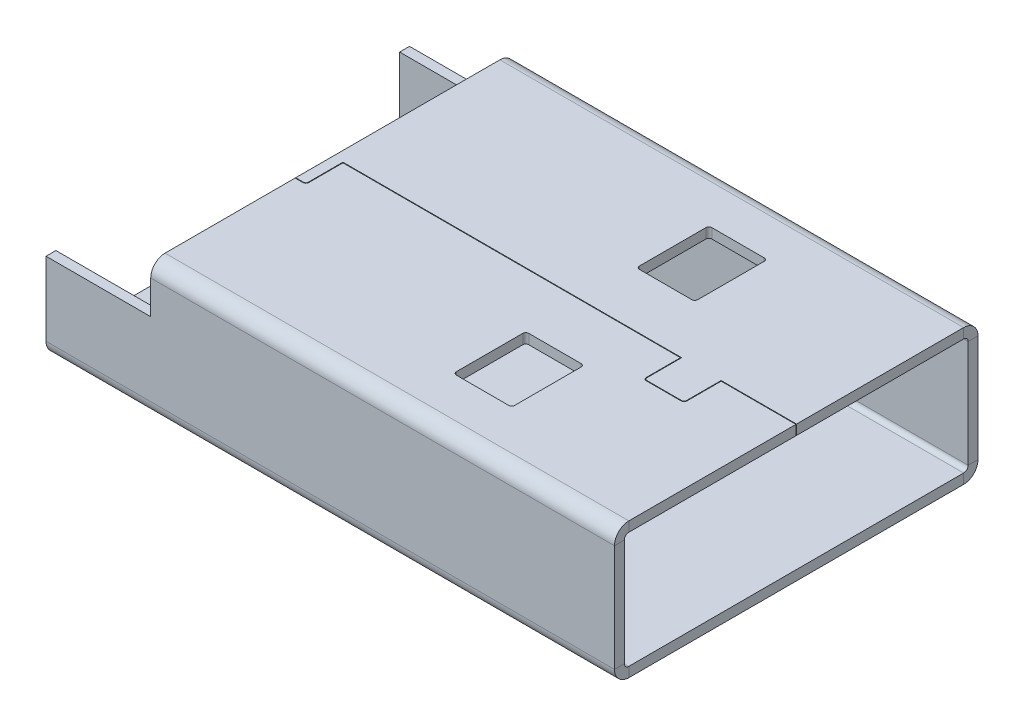
from build123d import *

# Parameters (mm, degrees)
BASE_FLANGE1_DEPTH  = 19
CUT_EXTRUDE1_DEPTH  = 0.33
TAB1_DEPTH          = 0.33
CUT_EXTRUDE2_DEPTH  = 21.457693541
SKETCH_1_W          = 4.170383739
SKETCH_1_H          = 15.60949608
CUT_EXTRUDE_1_DEPTH = 1.6


# Sheet-metal steps are written as plain solids
with BuildPart() as part:
    # Sketch1 → Base-Flange1 (new body)
    with BuildSketch(Plane(origin=(0, 0, 0), x_dir=(0, 0, -1), z_dir=(1, 0, 0))):
        with BuildLine():
            Line((0.01, 2.27), (5.595, 2.27))
            ThreePointArc((5.595, 2.27), (5.934411255, 2.129411255), (6.075, 1.79))
            Line((6.075, 1.79), (6.075, -1.79))
            ThreePointArc((6.075, -1.79), (5.934411255, -2.129411255), (5.595, -2.27))
            Line((5.595, -2.27), (-5.595, -2.27))
            ThreePointArc((-5.595, -2.27), (-5.934411255, -2.129411255), (-6.075, -1.79))
            Line((-6.075, -1.79), (-6.075, 1.79))
            ThreePointArc((-6.075, 1.79), (-5.934411255, 2.129411255), (-5.595, 2.27))
            Line((-5.595, 2.27), (-0.01, 2.27))
            Line((-0.01, 2.27), (-0.01, 1.94))
            Line((-0.01, 1.94), (-5.595, 1.94))
            ThreePointArc((-5.595, 1.94), (-5.701066017, 1.896066017), (-5.745, 1.79))
            Line((-5.745, 1.79), (-5.745, -1.79))
            ThreePointArc((-5.745, -1.79), (-5.701066017, -1.896066017), (-5.595, -1.94))
            Line((-5.595, -1.94), (5.595, -1.94))
            ThreePointArc((5.595, -1.94), (5.701066017, -1.896066017), (5.745, -1.79))
            Line((5.745, -1.79), (5.745, 1.79))
            ThreePointArc((5.745, 1.79), (5.701066017, 1.896066017), (5.595, 1.94))
            Line((5.595, 1.94), (0.01, 1.94))
            Line((0.01, 1.94), (0.01, 2.27))
        make_face()
    extrude(amount=BASE_FLANGE1_DEPTH)

    # Sketch6 → Cut-Extrude1 (cut)
    with BuildSketch(Plane(origin=(0, 2.27, 0), x_dir=(1, 0, 0), z_dir=(0, 1, 0))):
        with BuildLine():
            Line((16.5, 0.01), (16.5, -1.15))
            ThreePointArc((16.5, -1.15), (16.470710678, -1.220710678), (16.4, -1.25))
            Line((16.4, -1.25), (15.24, -1.25))
            ThreePointArc((15.24, -1.25), (15.169289322, -1.220710678), (15.14, -1.15))
            Line((15.14, -1.15), (15.14, 0.01))
            Line((15.14, 0.01), (16.5, 0.01))
        make_face()
        with BuildLine():
            Line((3.86, 0.01), (2.5, 0.01))
            Line((2.5, 0.01), (2.5, -1.15))
            ThreePointArc((2.5, -1.15), (2.529289322, -1.220710678), (2.6, -1.25))
            Line((2.6, -1.25), (3.76, -1.25))
            ThreePointArc((3.76, -1.25), (3.830710678, -1.220710678), (3.86, -1.15))
            Line((3.86, -1.15), (3.86, 0.01))
        make_face()
    extrude(amount=-CUT_EXTRUDE1_DEPTH, mode=Mode.SUBTRACT)

    # Sketch7 → Tab1 (add)
    with BuildSketch(Plane(origin=(0, 2.27, 0), x_dir=(1, 0, 0), z_dir=(0, 1, 0))):
        with BuildLine():
            Line((15.16, -0.01), (15.16, 0.01))
            Line((15.16, 0.01), (16.48, 0.01))
            Line((16.48, 0.01), (16.48, -0.01))
            Line((16.48, -0.01), (16.48, -1.15))
            ThreePointArc((16.48, -1.15), (16.456568542, -1.206568542), (16.4, -1.23))
            Line((16.4, -1.23), (15.24, -1.23))
            ThreePointArc((15.24, -1.23), (15.183431458, -1.206568542), (15.16, -1.15))
            Line((15.16, -1.15), (15.16, -0.01))
        make_face()
        with BuildLine():
            Line((2.52, -0.01), (2.52, 0.01))
            Line((2.52, 0.01), (3.84, 0.01))
            Line((3.84, 0.01), (3.84, -0.01))
            Line((3.84, -0.01), (3.84, -1.15))
            ThreePointArc((3.84, -1.15), (3.816568542, -1.206568542), (3.76, -1.23))
            Line((3.76, -1.23), (2.6, -1.23))
            ThreePointArc((2.6, -1.23), (2.543431458, -1.206568542), (2.52, -1.15))
            Line((2.52, -1.15), (2.52, -0.01))
        make_face()
    extrude(amount=-TAB1_DEPTH)

    # Sketch10 → Cut-Extrude2 (cut, through all)
    with BuildSketch(Plane(origin=(0, 2.27, 0), x_dir=(1, 0, 0), z_dir=(0, 1, 0))):
        with BuildLine():
            Line((11.9, -1.84), (13.65, -1.84))
            ThreePointArc((13.65, -1.84), (13.720710678, -1.869289322), (13.75, -1.94))
            Line((13.75, -1.94), (13.75, -4.16))
            ThreePointArc((13.75, -4.16), (13.720710678, -4.230710678), (13.65, -4.26))
            Line((13.65, -4.26), (11.9, -4.26))
            ThreePointArc((11.9, -4.26), (11.829289322, -4.230710678), (11.8, -4.16))
            Line((11.8, -4.16), (11.8, -1.94))
            ThreePointArc((11.8, -1.94), (11.829289322, -1.869289322), (11.9, -1.84))
        make_face()
        with BuildLine():
            Line((13.75, 1.96), (13.75, 4.18))
            ThreePointArc((13.75, 4.18), (13.720710678, 4.250710678), (13.65, 4.28))
            Line((13.65, 4.28), (11.9, 4.28))
            ThreePointArc((11.9, 4.28), (11.829289322, 4.250710678), (11.8, 4.18))
            Line((11.8, 4.18), (11.8, 1.96))
            ThreePointArc((11.8, 1.96), (11.829289322, 1.889289322), (11.9, 1.86))
            Line((11.9, 1.86), (13.65, 1.86))
            ThreePointArc((13.65, 1.86), (13.720710678, 1.889289322), (13.75, 1.96))
        make_face()
    extrude(amount=-CUT_EXTRUDE2_DEPTH, mode=Mode.SUBTRACT)

    # Эскиз1 → Вырез-Вытянуть1 (cut)
    with BuildSketch(Plane(origin=(0, 2.27, 0), x_dir=(1, 0, 0), z_dir=(0, 1, 0))):
        with Locations((1.41480813, -0.01)):
            Rectangle(SKETCH_1_W, SKETCH_1_H)
    extrude(amount=-CUT_EXTRUDE_1_DEPTH, mode=Mode.SUBTRACT)


solid = part.part
